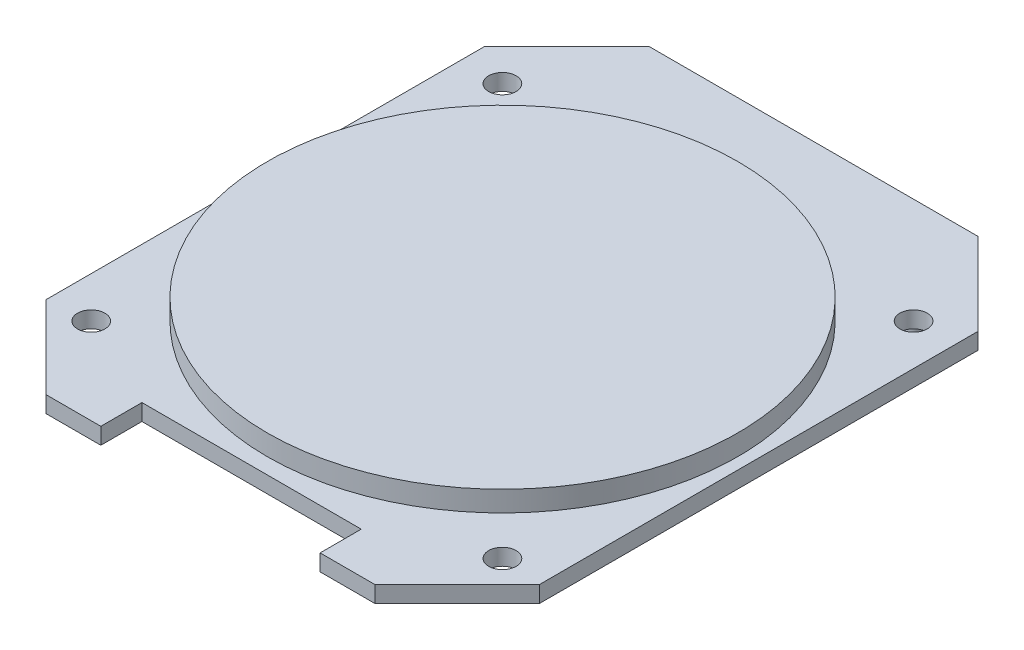
from build123d import *

# Parameters (mm, degrees)
SKETCH_1_R      = 1
EXTRUDE_1_DEPTH = 1.2
SKETCH_2_R      = 17.16
EXTRUDE_2_DEPTH = 1.5
SKETCH_3_W      = 12
SKETCH_3_H      = 4.5
SKETCH_3_W_2    = 22.86
SKETCH_3_H_2    = 2.54
EXTRUDE_3_DEPTH = 2
SKETCH_4_R      = 0.5
EXTRUDE_4_DEPTH = 8


with BuildPart() as part:
    # 草图1 → 凸台-拉伸1 (new body)
    with BuildSketch(Plane(origin=(0, 0, 0), x_dir=(1, 0, 0), z_dir=(0, 1, 0))):
        Polygon((-12, 44), (12, 44), (18, 38), (18, 6), (12, 0), (8, 0), (8, 3), (-8, 3), (-8, 0), (-12, 0), (-18, 6), (-18, 38), align=None)
        with Locations((15, 6.3)):
            Circle(SKETCH_1_R, mode=Mode.SUBTRACT)
        with Locations((15, 36.3)):
            Circle(SKETCH_1_R, mode=Mode.SUBTRACT)
        with Locations((-15, 6.3)):
            Circle(SKETCH_1_R, mode=Mode.SUBTRACT)
        with Locations((-15, 36.3)):
            Circle(SKETCH_1_R, mode=Mode.SUBTRACT)
    extrude(amount=EXTRUDE_1_DEPTH)

    # 草图2 → 凸台-拉伸2 (add)
    with BuildSketch(Plane(origin=(0, 1.2, 0), x_dir=(1, 0, 0), z_dir=(0, 1, 0))):
        with Locations((0, 21.31)):
            Circle(SKETCH_2_R)
    extrude(amount=EXTRUDE_2_DEPTH)

    # 草图3 → 凸台-拉伸3 (add)
    with BuildSketch(Plane.XZ):
        with Locations((0, -30.25)):
            Rectangle(SKETCH_3_W, SKETCH_3_H)
        with Locations((0, -42.73)):
            Rectangle(SKETCH_3_W_2, SKETCH_3_H_2)
    extrude(amount=EXTRUDE_3_DEPTH)

    # 草图4 → 凸台-拉伸4 (add)
    with BuildSketch(Plane.XZ):
        with Locations((-1.27, -42.5)):
            Circle(SKETCH_4_R)
        with Locations((-3.81, -42.5)):
            Circle(SKETCH_4_R)
        with Locations((-6.35, -42.5)):
            Circle(SKETCH_4_R)
        with Locations((-8.89, -42.5)):
            Circle(SKETCH_4_R)
        with Locations((8.89, -42.5)):
            Circle(SKETCH_4_R)
        with Locations((6.35, -42.5)):
            Circle(SKETCH_4_R)
        with Locations((3.81, -42.5)):
            Circle(SKETCH_4_R)
        with Locations((1.27, -42.5)):
            Circle(SKETCH_4_R)
    extrude(amount=EXTRUDE_4_DEPTH)


solid = part.part
